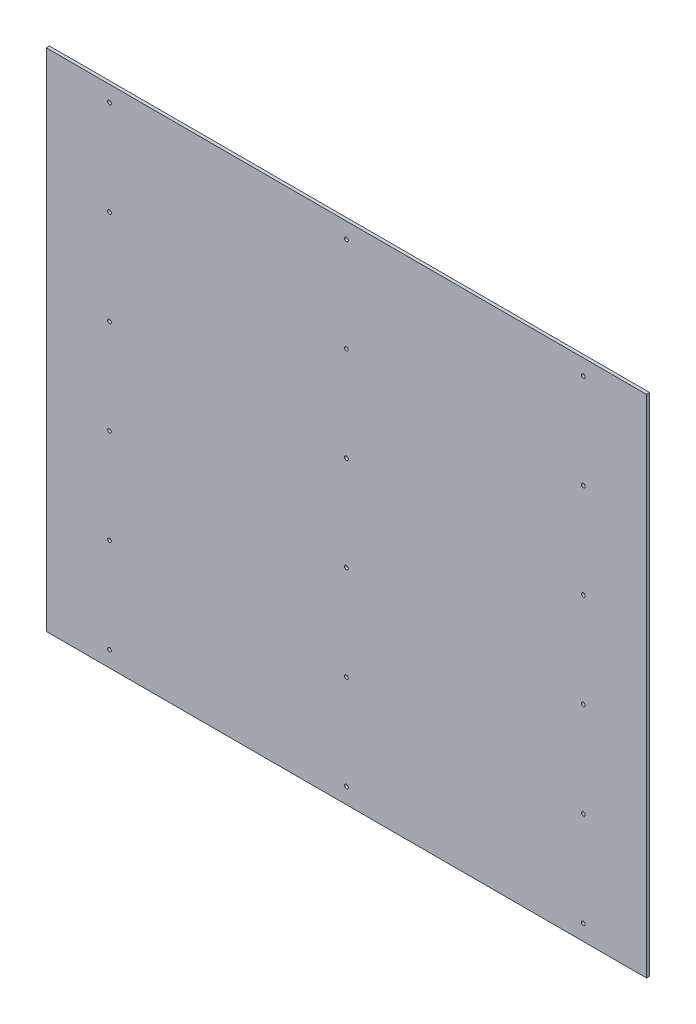
from build123d import *

# Parameters (mm, degrees)
SZKIC1_W                    = 1900
SZKIC1_H                    = 1600
DODANIE_WYCI_GNI_CIE1_DEPTH = 10
OTW_R_POD_RUB_M101_D        = 12
SZYK_LINIOWY1_COUNT         = 6
SZYK_LINIOWY1_PITCH         = 300
SZYK_LINIOWY1_COUNT_DIR2    = 3
SZYK_LINIOWY1_PITCH_DIR2    = 750


with BuildPart() as part:
    # Szkic1 → Dodanie-wyciągnięcie1 (new body)
    with BuildSketch(Plane.XY):
        Rectangle(SZKIC1_W, SZKIC1_H)
    extrude(amount=DODANIE_WYCI_GNI_CIE1_DEPTH)

    # Otwór pod śrubę M101 (through all)
    with Locations(Plane.XY.offset(10)):
        with Locations((-750, -750)):
            otw_r_pod_rub_m101 = Hole(OTW_R_POD_RUB_M101_D / 2)

    # Szyk liniowy1: Otw_r pod _rub_ M101 6 × 3
    with Locations(*[(j * SZYK_LINIOWY1_PITCH_DIR2, i * SZYK_LINIOWY1_PITCH, 0) for i in range(SZYK_LINIOWY1_COUNT) for j in range(SZYK_LINIOWY1_COUNT_DIR2) if (i, j) != (0, 0)]):
        add(otw_r_pod_rub_m101, mode=Mode.SUBTRACT)


solid = part.part
